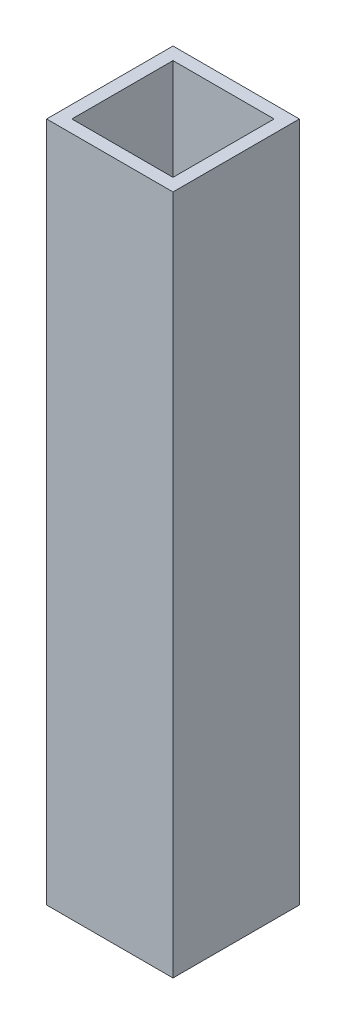
from build123d import *

# Parameters (mm, degrees)
SKETCH1_W           = 15
SKETCH1_H           = 15
SKETCH1_W_2         = 12
SKETCH1_H_2         = 12
EXTRUDE_THIN1_DEPTH = 80.79


with BuildPart() as part:
    # Sketch1 → Extrude-Thin1 (new body)
    with BuildSketch(Plane(origin=(0, 0, 0), x_dir=(1, 0, 0), z_dir=(0, 1, 0))):
        with Locations((7.5, 7.5)):
            Rectangle(SKETCH1_W, SKETCH1_H)
        with Locations((7.5, 7.5)):
            Rectangle(SKETCH1_W_2, SKETCH1_H_2, mode=Mode.SUBTRACT)
    extrude(amount=EXTRUDE_THIN1_DEPTH)


solid = part.part
